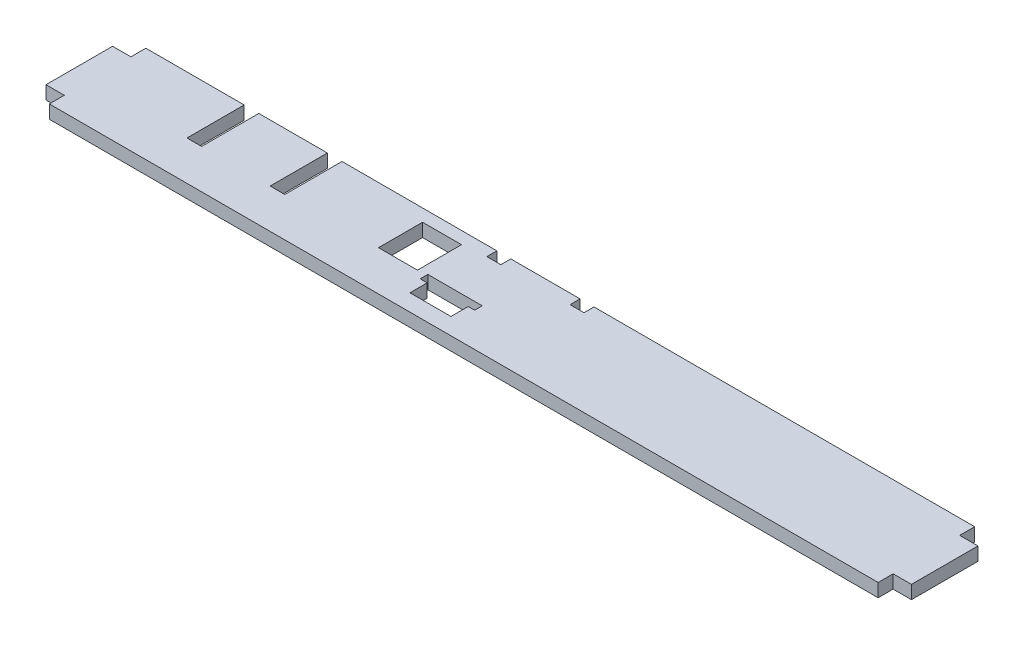
from build123d import *

# Parameters (mm, degrees)
EXTRUDE_1_DEPTH    = 4
SKETCH_2_W         = 20
SKETCH_2_H         = 4
EXTRUDE_2_DEPTH    = 5.5
SKETCH1_W          = 4.4
SKETCH1_H          = 17.190587951
CUT_EXTRUDE1_DEPTH = 10
LPATTERN1_COUNT    = 2
LPATTERN1_PITCH    = 25
SKETCH3_W          = 11.685912807
SKETCH3_H          = 13.236550351
CUT_EXTRUDE3_DEPTH = 10
CUT_EXTRUDE4_DEPTH = 10


with BuildPart() as part:
    # Эскиз1 → Бобышка-Вытянуть1 (new body)
    with BuildSketch(Plane(origin=(0, 0, 0), x_dir=(1, 0, 0), z_dir=(0, 1, 0))):
        Polygon((-14.85, 14.498494424), (5.95, 14.498494424), (5.95, 11.498494424), (10.15, 11.498494424), (10.15, 14.498494424), (124.5, 14.498494424), (124.5, -14.498494424), (-124.5, -14.498494424), (-124.5, 14.498494424), (-19.05, 14.498494424), (-19.05, 11.498494424), (-14.85, 11.498494424), align=None)
    extrude(amount=EXTRUDE_1_DEPTH)

    # Эскиз2 → Бобышка-Вытянуть2 (add)
    with BuildSketch(Plane(origin=(124.5, 0, 0), x_dir=(0, 0, -1), z_dir=(1, 0, 0))):
        with Locations((0, 2)):
            Rectangle(SKETCH_2_W, SKETCH_2_H)
    extrude_2 = extrude(amount=EXTRUDE_2_DEPTH)

    # Mirror1: Бобышка-Вытянуть2 across plane
    add(extrude_2.mirror(Plane(origin=(0, 0, 0), x_dir=(0, 0, 1), z_dir=(1, 0, 0))))

    # Sketch1 → Cut-Extrude1 (cut)
    with BuildSketch(Plane(origin=(0, 4, 0), x_dir=(1, 0, 0), z_dir=(0, 1, 0))):
        with Locations((-67.763838692, 5.903200448)):
            Rectangle(SKETCH1_W, SKETCH1_H)
    cut_extrude1 = extrude(amount=-CUT_EXTRUDE1_DEPTH, mode=Mode.SUBTRACT)

    # LPattern1: Cut-Extrude1 ×2
    with Locations(*[(-i * LPATTERN1_PITCH, 0, 0) for i in range(1, LPATTERN1_COUNT)]):
        add(cut_extrude1, mode=Mode.SUBTRACT)

    # Sketch3 → Cut-Extrude3 (cut)
    with BuildSketch(Plane(origin=(0, 0, 0), x_dir=(1, 0, 0), z_dir=(0, 1, 0))):
        with Locations((-31.80775481, 4.169260767)):
            Rectangle(SKETCH3_W, SKETCH3_H)
    extrude(amount=CUT_EXTRUDE3_DEPTH, mode=Mode.SUBTRACT)

    # Sketch2 → Cut-Extrude4 (cut)
    with BuildSketch(Plane.XZ):
        Polygon((-23.2847421, 4.289036164), (-23.2847421, 1.999681952), (-6.93161096, 1.999681952), (-6.93161096, 4.289036164), (-8.870976715, 4.289036164), (-8.870976715, 9.47165682), (-21.188250615, 9.47165682), (-21.188250615, 4.289036164), align=None)
    extrude(amount=-CUT_EXTRUDE4_DEPTH, mode=Mode.SUBTRACT)


solid = part.part
